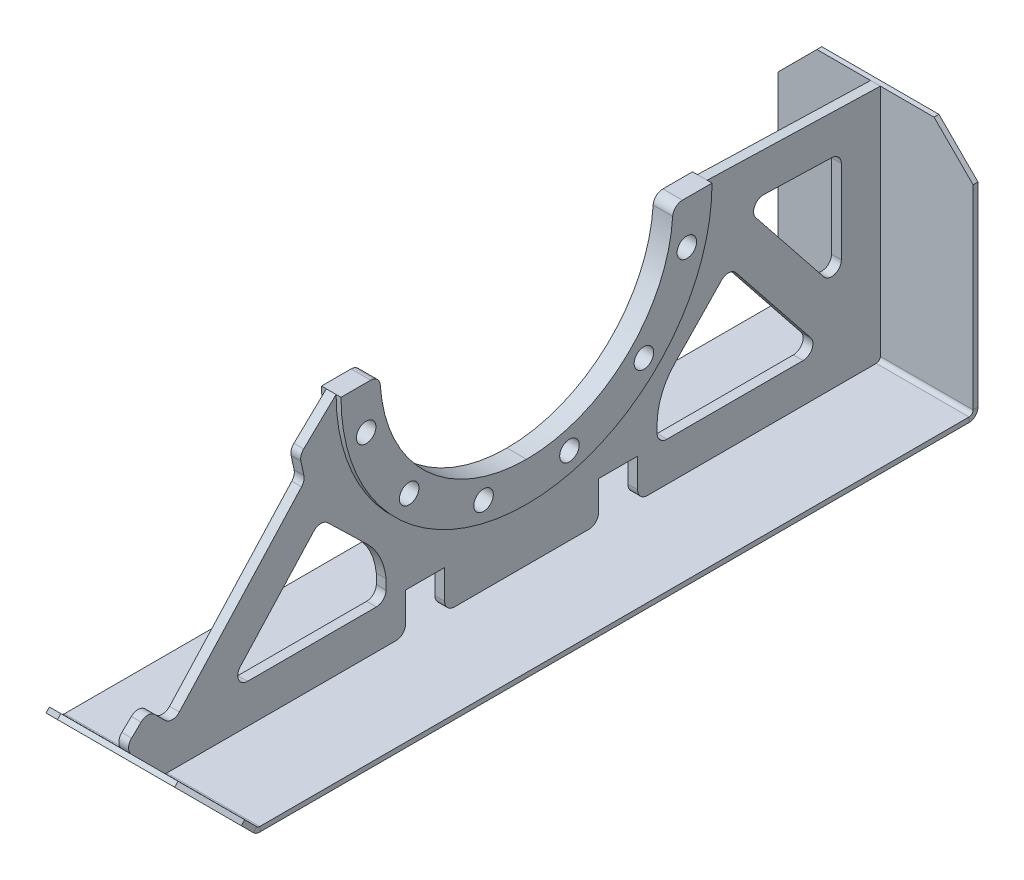
from build123d import *

# Parameters (mm, degrees)
FLANGE_PROFILE_DEPTH              = 12.7
F_7_8_1_DIAMETER_HOLE1_D          = 25.4
BOLT_PATTERN_COUNT                = 12
SKETCH5_W                         = 254
SKETCH5_H                         = 1317.865260112
BASE_SKID_DEPTH                   = 6.35
BEND_START                        = -127
BEND_HEEL_DEPTH                   = 254
BEND_HEEL_2_DEPTH                 = 254
BEND_TOE_DEPTH                    = 254
BEND_TOE_2_DEPTH                  = 254
WEBBING_BODY_DEPTH                = 6.35
WEBBING_HOLES_DEPTH               = 623.746559258
WEBBING_HOLES_DEPTH_BACK          = 623.746559258
CROSSBEAM_DEPTH                   = 623.746559258
CROSSBEAM_DEPTH_BACK              = 623.746559258
CROSSMEMBER_W                     = 50.8
CROSSMEMBER_H                     = 50.8
CROSSBEAM_CLEARANCE_DEPTH         = 6.35
CROSSBEAM_FILLET_R                = 12.7
FILLET_CLEARANCE_R                = 82.7
WEBBING_FILLET_R                  = 12.7
SKID_START                        = -376
SKID_EDGES_OUTLINE_W              = 201
SKID_EDGES_OUTLINE_H              = 6.35
SKID_EDGES_DEPTH                  = 37.146275522
SKID_START_2                      = 338.853724478
SKID_EDGES_2_OUTLINE_W            = 200
SKID_EDGES_2_OUTLINE_H            = 6.35
SKID_EDGES_2_DEPTH                = 37.146275522
SKID_START_3                      = -310
SKID_EDGES_3_OUTLINE_W            = 200
SKID_EDGES_3_OUTLINE_H            = 9
SKID_EDGES_3_DEPTH                = 37.152572811
SKID_START_4                      = 272.847427189
SKID_EDGES_4_OUTLINE_W            = 201
SKID_EDGES_4_OUTLINE_H            = 9
SKID_EDGES_4_DEPTH                = 37.152572811
FLANGE_FILLET_R                   = 12.7
CONVERT_START                     = -12.7
CONVERT_FLANGE_TO_SHEET_OUTLINE_R = 12.7
CONVERT_FLANGE_TO_SHEET_DEPTH     = 25.4
CONVERT_START_2                   = -6.35
CONVERT_WEBBING_TO_SHEET_DEPTH    = 12.7
FILLET2_R                         = 12.7


with BuildPart() as part:
    # Sketch1 → Flange Profile (new, symmetric)
    with BuildSketch(Plane(origin=(0, 0, 0), x_dir=(0, 0, -1), z_dir=(1, 0, 0))):
        with BuildLine():
            Line((241.3, 316.3), (190.5, 316.3))
            ThreePointArc((190.5, 316.3), (0, 125.8), (-190.5, 316.3))
            Line((-190.5, 316.3), (-241.3, 316.3))
            ThreePointArc((-241.3, 316.3), (0, 75), (241.3, 316.3))
        make_face()
    extrude(amount=FLANGE_PROFILE_DEPTH, both=True)

    # 7/8 (1) Diameter Hole1 (through all)
    with Locations(Plane(origin=(12.7, 260.420968162, -208.543385896), x_dir=(0, 0, 1), z_dir=(1, 0, 0))):
        with Locations((0, 0)):
            f_7_8_1_diameter_hole1 = Hole(F_7_8_1_DIAMETER_HOLE1_D / 2)

    # Bolt Pattern: 7/8 (1) Diameter Hole1 ×12 about axis
    bolt_pattern_axis = Axis((0, 316.3, 0), (1, 0, 0))
    for i in range(1, BOLT_PATTERN_COUNT):
        add(f_7_8_1_diameter_hole1.rotate(bolt_pattern_axis, i * 360 / BOLT_PATTERN_COUNT), mode=Mode.SUBTRACT)

    # Flange Fillet
    flange_fillet_edges = [part.edges().sort_by_distance(p)[0] for p in [
        (0, 316.3, 190.5),
        (0, 316.3, -190.5),
    ]]
    fillet(flange_fillet_edges, radius=FLANGE_FILLET_R)


with BuildPart() as body_2:
    # Base Skid: sheet metal written as solids
    # Sketch5 → Base Skid (new body)
    with BuildSketch(Plane(origin=(0, 0, 0), x_dir=(1, 0, 0), z_dir=(0, 1, 0))):
        with Locations((0, 118.6125)):
            Rectangle(SKETCH5_W, SKETCH5_H)
    extrude(amount=-BASE_SKID_DEPTH)

    # Bend Heel: read off the stored shape, not the designer's step
    # Bend Heel outline → Bend Heel (cut)
    with BuildSketch(Plane.YZ.offset(BEND_START)):
        with BuildLine():
            Line((0, -777.545130056), (0, -471.640528076))
            ThreePointArc((0, -471.640528076), (-4.636915504, -467.33583609), (-6.35, -461.245130056))
            Line((-6.35, -461.245130056), (-6.35, -777.545130056))
            Line((-6.35, -777.545130056), (0, -777.545130056))
        make_face()
    extrude(amount=BEND_HEEL_DEPTH, mode=Mode.SUBTRACT)

    # Bend Heel 2 outline → Bend Heel 2 (add)
    with BuildSketch(Plane.YZ.offset(BEND_START)):
        with BuildLine():
            Line((5.334, -472.929130056), (309.66453199, -472.929130056))
            Line((309.66453199, -472.929130056), (309.66453199, -466.579130056))
            Line((309.66453199, -466.579130056), (5.334, -466.579130056))
            ThreePointArc((5.334, -466.579130056), (1.56229243, -465.016837626), (0, -461.245130056))
            Line((0, -461.245130056), (0, -471.640528076))
            ThreePointArc((0, -471.640528076), (2.590277571, -472.602411563), (5.334, -472.929130056))
        make_face()
    extrude(amount=BEND_HEEL_2_DEPTH)

    # Bend Toe: read off the stored shape, not the designer's step
    # Bend Toe outline → Bend Toe (cut)
    with BuildSketch(Plane.YZ.offset(BEND_START)):
        with BuildLine():
            Line((-6.35, 540.320130056), (-6.35, 461.245130056))
            ThreePointArc((-6.35, 461.245130056), (-5.460608458, 465.71640328), (-2.927835631, 469.506965687))
            Line((-2.927835631, 469.506965687), (0, 472.434801318))
            Line((0, 472.434801318), (0, 540.320130056))
            Line((0, 540.320130056), (-6.35, 540.320130056))
        make_face()
    extrude(amount=BEND_TOE_DEPTH, mode=Mode.SUBTRACT)

    # Bend Toe 2 outline → Bend Toe 2 (add)
    with BuildSketch(Plane.YZ.offset(BEND_START)):
        with BuildLine():
            Line((48.754787092, 521.189588411), (0, 472.434801318))
            Line((0, 472.434801318), (0, 461.245130056))
            ThreePointArc((0, 461.245130056), (0.406026574, 463.286363484), (1.562292429, 465.016837626))
            Line((1.562292429, 465.016837626), (53.244915153, 516.69946035))
            Line((53.244915153, 516.69946035), (48.754787092, 521.189588411))
        make_face()
    extrude(amount=BEND_TOE_2_DEPTH)

    # Skid Edges: read off the stored shape, not the designer's step
    # Skid Edges outline → Skid Edges (cut)
    with BuildSketch(Plane(origin=(0, 0, 0), x_dir=(0.7071067811865501, 0.4999999999999991, 0.499999999999997), z_dir=(0.7071067811865449, -0.5000000000000029, -0.5000000000000008)).offset(SKID_START)):
        with Locations((258.5, 330.886851681)):
            Rectangle(SKID_EDGES_OUTLINE_W, SKID_EDGES_OUTLINE_H)
    extrude(amount=SKID_EDGES_DEPTH, mode=Mode.SUBTRACT)

    # Skid Edges 2 outline → Skid Edges 2 (cut)
    with BuildSketch(Plane(origin=(0, 0, 0), x_dir=(0.7071067811865501, -0.4999999999999991, -0.499999999999997), z_dir=(0.7071067811865449, 0.5000000000000029, 0.5000000000000008)).offset(SKID_START_2)):
        with Locations((-258, -330.886851681)):
            Rectangle(SKID_EDGES_2_OUTLINE_W, SKID_EDGES_2_OUTLINE_H)
    extrude(amount=SKID_EDGES_2_DEPTH, mode=Mode.SUBTRACT)

    # Skid Edges 3 outline → Skid Edges 3 (cut)
    with BuildSketch(Plane(origin=(0, 0, 0), x_dir=(0.7071067811865474, 0.7071067811865477, 0), z_dir=(0.7071067811865476, -0.7071067811865476, 0)).offset(SKID_START_3)):
        with Locations((192, -469.5)):
            Rectangle(SKID_EDGES_3_OUTLINE_W, SKID_EDGES_3_OUTLINE_H)
    extrude(amount=SKID_EDGES_3_DEPTH, mode=Mode.SUBTRACT)

    # Skid Edges 4 outline → Skid Edges 4 (cut)
    with BuildSketch(Plane(origin=(0, 0, 0), x_dir=(0.707106781186548, -0.707106781186547, 0), z_dir=(0.707106781186547, 0.707106781186548, 0)).offset(SKID_START_4)):
        with Locations((-192.5, 469.5)):
            Rectangle(SKID_EDGES_4_OUTLINE_W, SKID_EDGES_4_OUTLINE_H)
    extrude(amount=SKID_EDGES_4_DEPTH, mode=Mode.SUBTRACT)


with BuildPart() as body_3:
    # Sketch12 → Webbing Body (new, symmetric)
    with BuildSketch(Plane(origin=(0, 0, 0), x_dir=(0, 0, -1), z_dir=(1, 0, 0))):
        with BuildLine():
            Line((-516.69946035, 53.244915153), (-465.016837626, 1.562292429))
            ThreePointArc((-465.016837626, 1.562292429), (-463.286363484, 0.406026574), (-461.245130056, 0))
            Line((-461.245130056, 0), (461.245130056, 0))
            ThreePointArc((461.245130056, 0), (465.016837626, 1.562292429), (466.579130056, 5.334))
            Line((466.579130056, 5.334), (466.579130056, 309.66453199))
            Line((466.579130056, 309.66453199), (241.3, 316.3))
            ThreePointArc((241.3, 316.3), (0, 75), (-241.3, 316.3))
            Line((-241.3, 316.3), (-516.69946035, 53.244915153))
        make_face()
    extrude(amount=WEBBING_BODY_DEPTH, both=True)

    # Sketch13 → Webbing Holes (cut, two sides: drawn at the far end of the back side and taken through both)
    with BuildSketch(Plane(origin=(0, 0, 0), x_dir=(0, 0, -1), z_dir=(1, 0, 0)).offset(-WEBBING_HOLES_DEPTH_BACK)):
        Polygon((415.779130056, 260.338785622), (287.40157486, 264.120073132), (415.779130056, 103.103449381), align=None)
        Polygon((-121.787355666, 50.8), (-385.355758001, 50.8), (-261.612051176, 186.371001392), align=None)
        Polygon((269.894826504, 204.589693285), (392.510394874, 50.8), (121.787355666, 50.8), align=None)
        Polygon((-454.135463722, 50.8), (-485.950787611, 82.615323889), (-288.586784033, 271.132776469), (-281.840137894, 239.563133553), align=None)
    extrude(amount=WEBBING_HOLES_DEPTH + WEBBING_HOLES_DEPTH_BACK, mode=Mode.SUBTRACT)

    # crossmember → Crossbeam (cut, two sides: drawn at the far end of the back side and taken through both)
    with BuildSketch(Plane(origin=(0, 0, 0), x_dir=(0, 0, -1), z_dir=(1, 0, 0)).offset(-CROSSBEAM_DEPTH_BACK)):
        with Locations((125.5, 25.4)):
            Rectangle(CROSSMEMBER_W, CROSSMEMBER_H)
        with Locations((-125.5, 25.4)):
            Rectangle(CROSSMEMBER_W, CROSSMEMBER_H)
    extrude(amount=CROSSBEAM_DEPTH + CROSSBEAM_DEPTH_BACK, mode=Mode.SUBTRACT)

    # crossmember<5> → Crossbeam Clearance (add, symmetric)
    with BuildSketch(Plane(origin=(0, 0, 0), x_dir=(0, 0, -1), z_dir=(1, 0, 0))):
        Polygon((100.1, 50.8), (150.9, 50.8), (150.9, 0), (176.3, 0), (176.3, 76.2), (74.7, 76.2), (74.7, 0), (100.1, 0), align=None)
        Polygon((-100.1, 0), (-74.7, 0), (-74.7, 76.2), (-176.3, 76.2), (-176.3, 0), (-150.9, 0), (-150.9, 50.8), (-100.1, 50.8), align=None)
    extrude(amount=CROSSBEAM_CLEARANCE_DEPTH, both=True)

    # Crossbeam fillet
    crossbeam_fillet_edges = [body_3.edges().sort_by_distance(p)[0] for p in [
        (0, 0, -150.9),
        (0, 0, -100.1),
        (0, 0, 100.1),
        (0, 0, 150.9),
    ]]
    fillet(crossbeam_fillet_edges, radius=CROSSBEAM_FILLET_R)

    # Fillet Clearance
    # the kernel refuses this fillet: 82.7 mm, written as the material it adds along each edge
    with BuildSketch(Plane(origin=(6.35, 76.2, -146.248876324), x_dir=(0, 0, -1), z_dir=(-1, 0, 0))) as fillet_clearance_piece_1:
        with BuildLine():
            CenterArc((112.722573697, 2.172867127), FILLET_CLEARANCE_R, 181.505567644, 42.416154829)
            Line((53.154741922, -55.194052066), (0, 0))
            Line((0, 0), (30.051123676, 0))
        make_face()
    extrude(amount=12.7)
    with BuildSketch(Plane(origin=(-6.35, 76.2, 147.984309509), x_dir=(0, 0.6961019539421004, 0.7179429432190206), z_dir=(1, 0, 0))) as fillet_clearance_piece_2:
        with BuildLine():
            CenterArc((73.916608705, 82.7), FILLET_CLEARANCE_R, 229.610877342, 40.389122658)
            Line((20.32905017, 19.710607478), (0, 0))
            Line((0, 0), (73.916608705, 0))
        make_face()
    extrude(amount=12.7)

    # Webbing Fillet
    webbing_fillet_edges = [body_3.edges().sort_by_distance(p)[0] for p in [
        (0, 53.244915153, 516.69946035),
        (0, 82.615323889, 485.950787611),
        (0, 271.132776469, 288.586784033),
        (0, 239.563133553, 281.840137894),
        (0, 50.8, 454.135463722),
        (0, 204.589693285, -269.894826504),
        (0, 50.8, -392.510394874),
        (0, 186.371001392, 261.612051176),
        (0, 50.8, 385.355758001),
        (0, 260.338785622, -415.779130056),
        (0, 103.103449381, -415.779130056),
        (0, 264.120073132, -287.40157486),
    ]]
    fillet(webbing_fillet_edges, radius=WEBBING_FILLET_R)


with BuildPart() as body_4:
    # Convert Flange to Sheet: read off the stored shape, not the designer's step
    # Convert Flange to Sheet outline → Convert Flange to Sheet (new body)
    with BuildSketch(Plane.YZ.offset(CONVERT_START)):
        with BuildLine():
            ThreePointArc((304.39375, 190.127565626), (312.856636133, 194.107641068), (316.3, 202.802736668))
            Line((316.3, 202.802736668), (316.3, 241.3))
            ThreePointArc((316.3, 241.3), (75, 0), (316.3, -241.3))
            Line((316.3, -241.3), (316.3, -202.802736668))
            ThreePointArc((316.3, -202.802736668), (312.856636133, -194.107641068), (304.39375, -190.127565626))
            ThreePointArc((304.39375, -190.127565626), (125.8, 0), (304.39375, 190.127565626))
        make_face()
        with Locations((163.635645942, -152.664354058)):
            Circle(CONVERT_FLANGE_TO_SHEET_OUTLINE_R, mode=Mode.SUBTRACT)
        with Locations((107.756614104, -55.879031838)):
            Circle(CONVERT_FLANGE_TO_SHEET_OUTLINE_R, mode=Mode.SUBTRACT)
        with Locations((260.420968162, -208.543385896)):
            Circle(CONVERT_FLANGE_TO_SHEET_OUTLINE_R, mode=Mode.SUBTRACT)
        with Locations((107.756614104, 55.879031838)):
            Circle(CONVERT_FLANGE_TO_SHEET_OUTLINE_R, mode=Mode.SUBTRACT)
        with Locations((163.635645942, 152.664354058)):
            Circle(CONVERT_FLANGE_TO_SHEET_OUTLINE_R, mode=Mode.SUBTRACT)
        with Locations((260.420968162, 208.543385896)):
            Circle(CONVERT_FLANGE_TO_SHEET_OUTLINE_R, mode=Mode.SUBTRACT)
    extrude(amount=CONVERT_FLANGE_TO_SHEET_DEPTH)


with BuildPart() as body_5:
    # Convert Webbing to Sheet: read off the stored shape, not the designer's step
    # Convert Webbing to Sheet outline → Convert Webbing to Sheet (new body)
    with BuildSketch(Plane.YZ.offset(CONVERT_START_2)):
        with BuildLine():
            ThreePointArc((12.7, -150.9), (3.719743879, -154.619743879), (0, -163.6))
            Line((0, -163.6), (0, -461.245130056))
            ThreePointArc((0, -461.245130056), (1.56229243, -465.016837626), (5.334, -466.579130056))
            Line((5.334, -466.579130056), (309.66453199, -466.579130056))
            Line((309.66453199, -466.579130056), (316.3, -241.3))
            ThreePointArc((316.3, -241.3), (75, 0), (316.3, 241.3))
            Line((316.3, 241.3), (276.032946761, 283.456663644))
            ThreePointArc((276.032946761, 283.456663644), (270.588863094, 286.821521817), (264.195081913, 287.104151799))
            Line((264.195081913, 287.104151799), (245.952992349, 283.205693921))
            ThreePointArc((245.952992349, 283.205693921), (239.977011634, 283.367384751), (234.737080357, 286.245163347))
            Line((234.737080357, 286.245163347), (60.617668132, 445.174294781))
            ThreePointArc((60.617668132, 445.174294781), (56.482733464, 454.264990592), (60.199179654, 463.534643376))
            Line((60.199179654, 463.534643376), (73.838585609, 477.174049331))
            ThreePointArc((73.838585609, 477.174049331), (77.557495428, 486.008756787), (74.042049988, 494.926379196))
            Line((74.042049988, 494.926379196), (62.220398575, 507.302784775))
            ThreePointArc((62.220398575, 507.302784775), (53.18222674, 511.229876971), (44.056421954, 507.510967151))
            Line((44.056421954, 507.510967151), (1.562292429, 465.016837626))
            ThreePointArc((1.562292429, 465.016837626), (0.406026574, 463.286363484), (0, 461.245130056))
            Line((0, 461.245130056), (0, 163.6))
            ThreePointArc((0, 163.6), (3.719743879, 154.619743879), (12.7, 150.9))
            Line((12.7, 150.9), (50.8, 150.9))
            Line((50.8, 150.9), (50.8, 100.1))
            Line((50.8, 100.1), (12.7, 100.1))
            ThreePointArc((12.7, 100.1), (3.719743879, 96.380256121), (0, 87.4))
            Line((0, 87.4), (0, -87.4))
            ThreePointArc((0, -87.4), (3.719743879, -96.380256121), (12.7, -100.1))
            Line((12.7, -100.1), (50.8, -100.1))
            Line((50.8, -100.1), (50.8, -150.9))
            Line((50.8, -150.9), (12.7, -150.9))
        make_face()
        with BuildLine():
            Line((131.394052066, -199.403618246), (194.156373438, -259.846997017))
            ThreePointArc((194.156373438, -259.846997017), (198.032828609, -269.588102319), (193.263931773, -278.924785894))
            Line((193.263931773, -278.924785894), (71.417230327, -376.07240504))
            ThreePointArc((71.417230327, -376.07240504), (57.98904841, -377.584278062), (50.8, -366.142275939))
            Line((50.8, -366.142275939), (50.8, -176.3))
            Line((50.8, -176.3), (76.2, -176.3))
            ThreePointArc((76.2, -176.3), (105.959731151, -182.685152645), (131.394052066, -199.403618246))
        make_face(mode=Mode.SUBTRACT)
        with BuildLine():
            Line((248.00734903, -415.779130056), (139.404356101, -415.779130056))
            ThreePointArc((139.404356101, -415.779130056), (127.41680757, -407.273016107), (131.487125774, -393.149000955))
            Line((131.487125774, -393.149000955), (242.701867121, -304.478177637))
            ThreePointArc((242.701867121, -304.478177637), (256.297905781, -303.048679283), (263.313592002, -314.782215819))
            Line((263.313592002, -314.782215819), (260.701843584, -403.453039137))
            ThreePointArc((260.701843584, -403.453039137), (256.854420711, -412.190624042), (248.00734903, -415.779130056))
        make_face(mode=Mode.SUBTRACT)
        with BuildLine():
            Line((177.260013842, 252.215196046), (127.653495748, 201.052217116))
            ThreePointArc((127.653495748, 201.052217116), (104.130662555, 184.094736548), (76.2, 176.3))
            Line((76.2, 176.3), (50.8, 176.3))
            Line((50.8, 176.3), (50.8, 356.568787103))
            ThreePointArc((50.8, 356.568787103), (58.373814726, 368.18826319), (72.061767643, 365.948879577))
            Line((72.061767643, 365.948879577), (176.703906107, 270.435783335))
            ThreePointArc((176.703906107, 270.435783335), (180.836227428, 261.443125193), (177.260013842, 252.215196046))
        make_face(mode=Mode.SUBTRACT)
    extrude(amount=CONVERT_WEBBING_TO_SHEET_DEPTH)

    # Fillet2
    fillet2_edges = [body_5.edges().sort_by_distance(p)[0] for p in [
        (0, 50.8, 176.3),
        (0, 50.8, -176.3),
    ]]
    fillet(fillet2_edges, radius=FILLET2_R)


solid = Compound([body_2.part, body_4.part, body_5.part])
